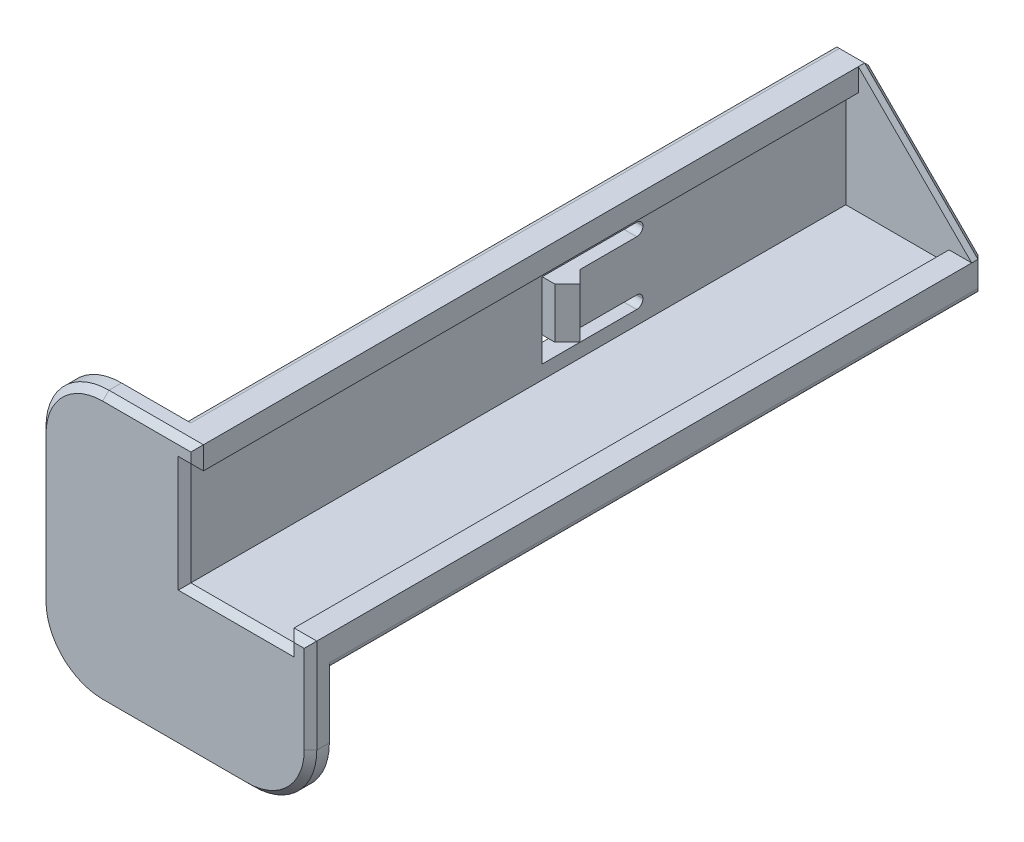
from build123d import *

# Parameters (mm, degrees)
BOSS_EXTRUDE1_DEPTH = 52.5
BOSS_EXTRUDE2_DEPTH = 1.5
CUT_EXTRUDE1_REACH  = 73.793
SKETCH5_W           = 2
SKETCH5_H           = 4
BOSS_EXTRUDE3_DEPTH = 1
FILLET1_R           = 5
BOSS_EXTRUDE4_DEPTH = 1
CHAMFER3_SIZE       = 0.5
CHAMFER4_SIZE       = 1
FILLET3_R           = 0.5
FILLET4_R           = 0.5


with BuildPart() as part:
    # Sketch1 → Boss-Extrude1 (new body)
    with BuildSketch(Plane.XY):
        Polygon((-121.6, -26.1), (-124.1, -26.1), (-124.1, -37.6), (-112.6, -37.6), (-112.6, -35.1), (-114.4, -35.1), (-114.4, -36.1), (-122.6, -36.1), (-122.6, -27.9), (-121.6, -27.9), align=None)
    extrude(amount=-BOSS_EXTRUDE1_DEPTH)

    # Sketch2 → Boss-Extrude2 (add)
    with BuildSketch(Plane.XY):
        Polygon((-124.1, -26.1), (-134.1, -26.1), (-134.1, -47.6), (-112.6, -47.6), (-112.6, -37.6), (-124.1, -37.6), align=None)
    extrude(amount=-BOSS_EXTRUDE2_DEPTH)

    # Sketch4 → Cut-Extrude1 (cut, up to next)
    with BuildSketch(Plane(origin=(-122.6, 0, 0), x_dir=(0, 0, -1), z_dir=(1, 0, 0)), mode=Mode.PRIVATE) as cut_extrude1_sk1:
        Polygon((36.4, -30), (36.4, -29), (28.4, -29), (28.4, -35), (36.4, -35), (36.4, -34), (29.4, -34), (29.4, -30), align=None)
    cut_extrude1_tool1 = extrude(cut_extrude1_sk1.sketch, amount=-CUT_EXTRUDE1_REACH, mode=Mode.PRIVATE) & part.part
    add(cut_extrude1_tool1.solids().sort_by_distance((-122.6, -29.5, -36.3))[0], mode=Mode.SUBTRACT)

    # Sketch5 → Boss-Extrude3 (add)
    with BuildSketch(Plane(origin=(-122.6, 0, 0), x_dir=(0, 0, -1), z_dir=(1, 0, 0))):
        with Locations((30.4, -32)):
            Rectangle(SKETCH5_W, SKETCH5_H)
    extrude(amount=BOSS_EXTRUDE3_DEPTH)

    # Fillet1
    fillet1_edges = [part.edges().sort_by_distance(p)[0] for p in [
        (-112.6, -47.6, -0.75),
        (-134.1, -47.6, -0.75),
        (-134.1, -26.1, -0.75),
    ]]
    fillet(fillet1_edges, radius=FILLET1_R)

    # Sketch6 → Boss-Extrude4 (add)
    with BuildSketch(Plane(origin=(0, 0, -52.5), x_dir=(-1, 0, 0), z_dir=(0, 0, -1))):
        Polygon((112.6, -35.1), (112.6, -37.6), (124.1, -37.6), (124.1, -26.1), (121.6, -26.1), align=None)
    extrude(amount=BOSS_EXTRUDE4_DEPTH)

    # Chamfer3
    chamfer3_edges = [part.edges().sort_by_distance(p)[0] for p in [
        (-118.5, -36.1, 0),
        (-114.4, -35.6, 0),
        (-117.1, -30.6, -53.5),
        (-113.5, -35.1, 0),
        (-112.6, -36.35, -53.5),
        (-118.35, -37.6, -53.5),
        (-124.1, -31.85, -53.5),
        (-122.85, -26.1, -53.5),
        (-125.35, -26.1, 0),
        (-121.6, -27, 0),
        (-134.1, -36.85, 0),
        (-123.35, -47.6, 0),
        (-112.6, -38.85, 0),
        (-114.064466094, -46.135533906, 0),
        (-132.635533906, -46.135533906, 0),
        (-132.635533906, -27.564466094, 0),
        (-122.1, -27.9, 0),
        (-122.6, -32, 0),
    ]]
    chamfer(chamfer3_edges, length=CHAMFER3_SIZE)

    # Chamfer4
    chamfer4_edges = [part.edges().sort_by_distance(p)[0] for p in [
        (-121.6, -32, -31.4),
        (-121.6, -32, -29.4),
    ]]
    chamfer(chamfer4_edges, length=CHAMFER4_SIZE - 0.0001)  # a hair under: the kernel refuses the full size

    # Fillet3
    fillet3_edges = [part.edges().sort_by_distance(p)[0] for p in [
        (-123.35, -29, -36.4),
        (-123.35, -30, -36.4),
        (-123.35, -34, -36.4),
        (-123.35, -35, -36.4),
    ]]
    fillet(fillet3_edges, radius=FILLET3_R - 0.0001)  # a hair under: the kernel refuses the full size

    # Fillet4
    fillet4_edges = [part.edges().sort_by_distance(p)[0] for p in [
        (-124.1, -26.1, -27.25),
        (-124.1, -37.6, -27.25),
        (-112.6, -37.6, -27.25),
    ]]
    fillet(fillet4_edges, radius=FILLET4_R)


solid = part.part
